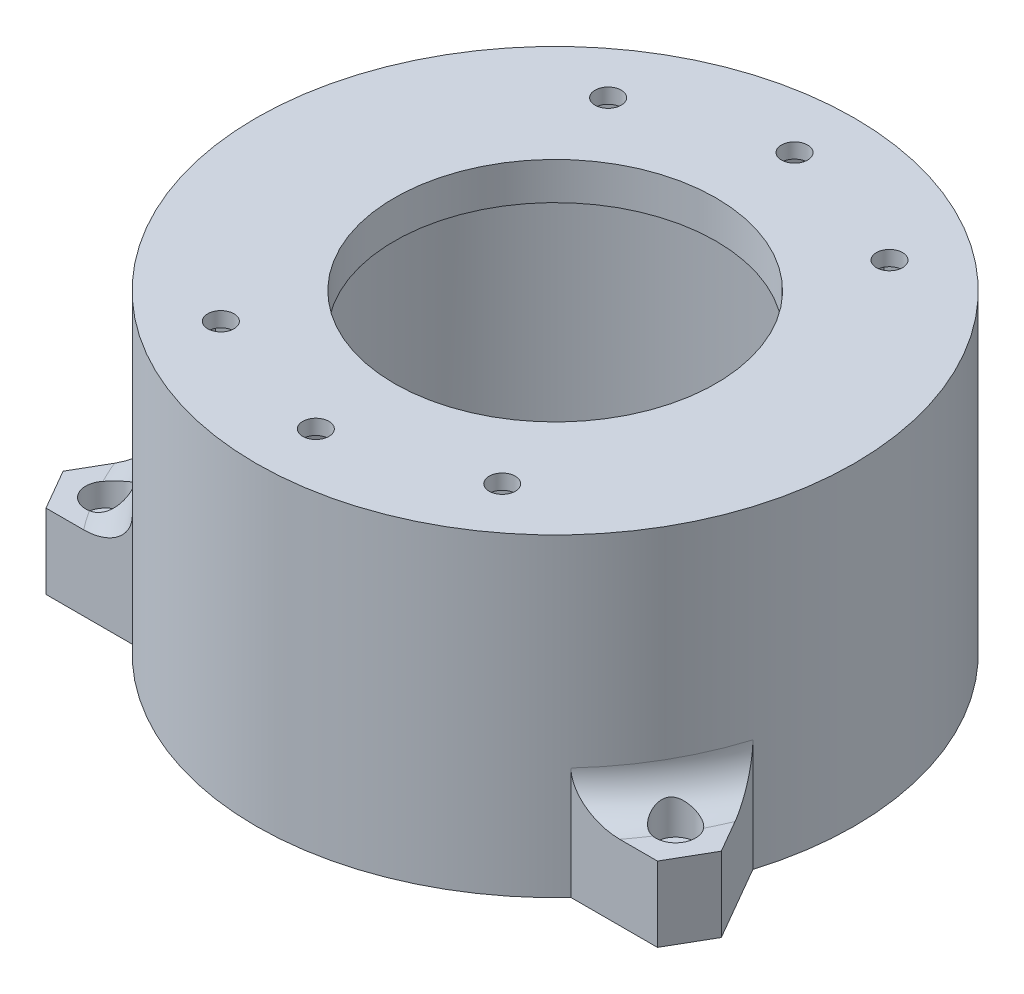
from build123d import *

# Parameters (mm, degrees)
SKETCH_1_W               = 40
SKETCH_1_H               = 39
CUT_EXTRUDE_1_DEPTH      = 3
CUT_EXTRUDE_2_DEPTH      = 3
CUT_EXTRUDE_3_DEPTH      = 3
CUT_EXTRUDE_4_DEPTH      = 3
CUT_EXTRUDE_5_DEPTH      = 3
CUT_EXTRUDE_6_DEPTH      = 3
HOLE_WIZARD_3_5_3_5_1_D  = 3.5
SKETCH_14_R              = 40
SKETCH_14_R_2            = 37
EXTRUDE_1_DEPTH          = 3
EXTRUDE_2_DEPTH          = 10
FILLET_1_R               = 5
FILLET_2_R               = 5
CUT_EXTRUDE_8_REACH      = 80.109
SKETCH_20_R              = 1.45
CUT_EXTRUDE_9_DEPTH      = 10
CUT_EXTRUDE_9_DEPTH_BACK = 3.1
SKETCH_21_R              = 3.121637526
SKETCH_21_R_2            = 2.750833309
SKETCH_21_R_3            = 2.66


with BuildPart() as part:
    # 草图1 → 旋转1 (revolve)
    with BuildSketch(Plane.XY, mode=Mode.PRIVATE) as revolve_1_sk:
        with Locations((20, 19.5)):
            Rectangle(SKETCH_1_W, SKETCH_1_H)
    revolve(revolve_1_sk.sketch.rotate(Axis((0, 39, 0), (0, -1, 0)), 270), axis=Axis((0, 39, 0), (0, -1, 0)))

    # 草图2 → M64 六角头螺栓的柱形沉头孔1 (revolve, cut)
    with BuildSketch(Plane(origin=(0, 39, 0), x_dir=(0, 0, 1), z_dir=(1, 0, 0))):
        Polygon((0, 0), (0, 39), (37, 39), (37, 5), (21.5, 5), (21.5, 0), align=None)
    revolve(axis=Axis((0, 45.35, 0), (0, -1, 0)), mode=Mode.SUBTRACT)

    # 草图4 → 切除-拉伸1 (cut)
    with BuildSketch(Plane.XZ.offset(-34)):
        Polygon((16.100028232, 27.856820067), (15.750000921, 24.52653266), (18.459100762, 22.558256413), (21.518227914, 23.920267573), (21.868255226, 27.25055498), (19.159155385, 29.218831227), align=None)
    extrude(amount=-CUT_EXTRUDE_1_DEPTH, mode=Mode.SUBTRACT)

    # 草图5 → 切除-拉伸2 (cut)
    with BuildSketch(Plane.XZ.offset(-34)):
        Polygon((-21.868255226, 27.25055498), (-21.518227914, 23.920267573), (-18.459100762, 22.558256413), (-15.750000921, 24.52653266), (-16.100028232, 27.856820067), (-19.159155385, 29.218831227), align=None)
    extrude(amount=-CUT_EXTRUDE_2_DEPTH, mode=Mode.SUBTRACT)

    # 草图6 → 切除-拉伸3 (cut)
    with BuildSketch(Plane.XZ.offset(-34)):
        Polygon((-18.459100762, -22.558256413), (-21.518227914, -23.920267573), (-21.868255226, -27.25055498), (-19.159155385, -29.218831227), (-16.100028232, -27.856820067), (-15.750000921, -24.52653266), align=None)
    extrude(amount=-CUT_EXTRUDE_3_DEPTH, mode=Mode.SUBTRACT)

    # 草图7 → 切除-拉伸4 (cut)
    with BuildSketch(Plane.XZ.offset(-34)):
        Polygon((1.674315781, -29.1), (-1.674315781, -29.1), (-3.348631561, -32), (-1.674315781, -34.9), (1.674315781, -34.9), (3.348631561, -32), align=None)
    extrude(amount=-CUT_EXTRUDE_4_DEPTH, mode=Mode.SUBTRACT)

    # 草图8 → 切除-拉伸5 (cut)
    with BuildSketch(Plane.XZ.offset(-34)):
        Polygon((21.868255226, -27.25055498), (21.518227914, -23.920267573), (18.459100762, -22.558256413), (15.750000921, -24.52653266), (16.100028232, -27.856820067), (19.159155385, -29.218831227), align=None)
    extrude(amount=-CUT_EXTRUDE_5_DEPTH, mode=Mode.SUBTRACT)

    # 草图9 → 切除-拉伸6 (cut)
    with BuildSketch(Plane.XZ.offset(-34)):
        Polygon((-3.348631561, 32), (-1.674315781, 29.1), (1.674315781, 29.1), (3.348631561, 32), (1.674315781, 34.9), (-1.674315781, 34.9), align=None)
    extrude(amount=-CUT_EXTRUDE_6_DEPTH, mode=Mode.SUBTRACT)

    # Ø3.5 (3.5) 直径孔1 (through all)
    with Locations(Plane(origin=(0, 37, 0), x_dir=(-1, 0, 0), z_dir=(0, -1, 0))):
        with Locations((18.809128073, 25.88854382), (-18.809128073, 25.88854382), (0, 32), (18.809128073, -25.88854382), (-18.809128073, -25.88854382), (0, -32)):
            Hole(HOLE_WIZARD_3_5_3_5_1_D / 2)

    # 草图14 → 凸台-拉伸1 (add)
    with BuildSketch(Plane.XZ):
        with Locations(Location((0, 0, 0), (0, 0, 270))):
            Circle(SKETCH_14_R)
        with Locations(Location((0, 0, 0), (0, 0, 90))):
            Circle(SKETCH_14_R_2, mode=Mode.SUBTRACT)
    extrude(amount=EXTRUDE_1_DEPTH)

    # 草图15 → 凸台-拉伸2 (add)
    with BuildSketch(Plane.XZ.offset(3)):
        Polygon((29.327322558, 27.208971895), (38.222658937, 11.791028105), (43.998438168, 21.790578059), (40.875075675, 27.204181918), align=None)
        Polygon((8.899999593, -39.002692308), (-8.899999593, -38.997307692), (-3.128024922, -48.99905421), (3.121974792, -49.000944875), align=None)
        Polygon((-38.227322151, 11.793720413), (-29.322659344, 27.206279587), (-40.870413246, 27.208476151), (-43.997050467, 21.796762958), align=None)
    extrude(amount=-EXTRUDE_2_DEPTH)

    # 圆角1
    # the kernel refuses this fillet: 5 mm, written as the material it adds along each edge
    with BuildSketch(Plane(origin=(0, 7, 0), x_dir=(0, 0, -1), z_dir=(1, 0, 0))) as fillet_1_piece_1_section:
        with BuildLine():
            CenterArc((40 + FILLET_1_R, FILLET_1_R), FILLET_1_R, 180, 90)
            Line((40 + FILLET_1_R, 0), (40, 0))
            Line((40, 0), (40, FILLET_1_R))
        make_face()
    fillet_1_piece_1 = revolve(axis=Axis((0, 7, 0), (0, 1, 0)), revolution_arc=30.760989805, mode=Mode.PRIVATE)
    fillet_1_piece_1 = split(fillet_1_piece_1, bisect_by=Plane(origin=(-6.938848229, 8.159603728, -42.395614154), z_dir=(0.866120495946599, 0, 0.4998352593617396)), keep=Keep.TOP, mode=Mode.PRIVATE)
    add(fillet_1_piece_1)
    with BuildSketch(Plane(origin=(0, 7, 0), x_dir=(0.510937919824611, 0, -0.8596176138756695), z_dir=(0.8596176138756695, 0, 0.510937919824611))) as fillet_1_piece_2_section:
        with BuildLine():
            CenterArc((40 + FILLET_1_R, FILLET_1_R), FILLET_1_R, 180, 90)
            Line((40 + FILLET_1_R, 0), (40, 0))
            Line((40, 0), (40, FILLET_1_R))
        make_face()
    fillet_1_piece_2 = revolve(axis=Axis((0, 7, 0), (0, 1, 0)), revolution_arc=30.726324325, mode=Mode.PRIVATE)
    fillet_1_piece_2 = split(fillet_1_piece_2, bisect_by=Plane(origin=(4.116270695, 8.159650312, -39.001245199), z_dir=(-0.0003025064822812723, 0, -0.9999999542449131)), keep=Keep.TOP, mode=Mode.PRIVATE)
    fillet_1_piece_2 = split(fillet_1_piece_2, bisect_by=Plane(origin=(6.938556974, 8.159650312, -42.396758511), z_dir=(-0.865817930630708, 0, 0.500359181986659)), keep=Keep.TOP, mode=Mode.PRIVATE)
    add(fillet_1_piece_2)

    # 圆角2
    # the kernel refuses this fillet: 5 mm, written as the material it adds along each edge
    with BuildSketch(Plane(origin=(0, 7, 0), x_dir=(-0.9999195538304662, 0, -0.01268407929183255), z_dir=(0.01268407929183255, 0, -0.9999195538304662))) as fillet_2_piece_1_section:
        with BuildLine():
            CenterArc((40 + FILLET_2_R, FILLET_2_R), FILLET_2_R, 180, 90)
            Line((40, FILLET_2_R), (40, 0))
            Line((40, 0), (40 + FILLET_2_R, 0))
        make_face()
    fillet_2_piece_1 = revolve(axis=Axis((0, 7, 0), (0, 1, 0)), revolution_arc=61.488192088, mode=Mode.PRIVATE)
    fillet_2_piece_1 = split(fillet_2_piece_1, bisect_by=Plane(origin=(-33.775857592, 8.159626542, 19.49849963), z_dir=(-0.8658741109182307, 0, 0.5002619554209213)), keep=Keep.TOP, mode=Mode.PRIVATE)
    fillet_2_piece_1 = split(fillet_2_piece_1, bisect_by=Plane(origin=(-41.214638413, 8.159626542, 16.972864045), z_dir=(0.8662327279326016, 0, 0.4996407319849368)), keep=Keep.TOP, mode=Mode.PRIVATE)
    fillet_2_piece_1 = split(fillet_2_piece_1, bisect_by=Plane(origin=(-35.303320955, 8.159626542, 27.207417203), z_dir=(-0.00019021565884901444, 0, -0.9999999819090014)), keep=Keep.TOP, mode=Mode.PRIVATE)
    add(fillet_2_piece_1)
    with BuildSketch(Plane(origin=(0, 7, 0), x_dir=(0.4889750420250284, 0, 0.8722977750038238), z_dir=(-0.8722977750038238, 0, 0.4889750420250284))) as fillet_2_piece_2_section:
        with BuildLine():
            CenterArc((40 + FILLET_2_R, FILLET_2_R), FILLET_2_R, 180, 90)
            Line((40, FILLET_2_R), (40, 0))
            Line((40, 0), (40 + FILLET_2_R, 0))
        make_face()
    fillet_2_piece_2 = revolve(axis=Axis((0, 7, 0), (0, 1, 0)), revolution_arc=61.488192088, mode=Mode.PRIVATE)
    fillet_2_piece_2 = split(fillet_2_piece_2, bisect_by=Plane(origin=(33.774124811, 8.159626542, 19.501500894), z_dir=(0.8661766174005117, 0, 0.49973799882399134)), keep=Keep.TOP, mode=Mode.PRIVATE)
    fillet_2_piece_2 = split(fillet_2_piece_2, bisect_by=Plane(origin=(35.306250644, 8.159626542, 27.206491851), z_dir=(-0.0004147973018910844, 0, -0.9999999139715955)), keep=Keep.TOP, mode=Mode.PRIVATE)
    fillet_2_piece_2 = split(fillet_2_piece_2, bisect_by=Plane(origin=(41.213974946, 8.159626542, 16.969864183), z_dir=(-0.8659302802877497, 0, 0.5001647225472617)), keep=Keep.TOP, mode=Mode.PRIVATE)
    add(fillet_2_piece_2)

    # 草图20 → 切除-拉伸8 (cut, up to next)
    with BuildSketch(Plane.XZ.offset(3), mode=Mode.PRIVATE) as cut_extrude_8_sk1:
        with Locations(Location((0.000280142, -44.000000314, 0), (0, 0, 270))):
            Circle(SKETCH_20_R)
    cut_extrude_8_tool1 = extrude(cut_extrude_8_sk1.sketch, amount=-CUT_EXTRUDE_8_REACH, mode=Mode.PRIVATE) & part.part
    # 草图20 → 切除-拉伸8 (cut, up to next)
    with BuildSketch(Plane.XZ.offset(3), mode=Mode.PRIVATE) as cut_extrude_8_sk2:
        with Locations(Location((-38.105258109, 21.999757547, 0), (0, 0, 270))):
            Circle(SKETCH_20_R)
    cut_extrude_8_tool2 = extrude(cut_extrude_8_sk2.sketch, amount=-CUT_EXTRUDE_8_REACH, mode=Mode.PRIVATE) & part.part
    # 草图20 → 切除-拉伸8 (cut, up to next)
    with BuildSketch(Plane.XZ.offset(3), mode=Mode.PRIVATE) as cut_extrude_8_sk3:
        with Locations(Location((38.104977967, 22.000242767, 0), (0, 0, 270))):
            Circle(SKETCH_20_R)
    cut_extrude_8_tool3 = extrude(cut_extrude_8_sk3.sketch, amount=-CUT_EXTRUDE_8_REACH, mode=Mode.PRIVATE) & part.part
    add(cut_extrude_8_tool1.solids().sort_by_distance((0.00028, -3, -44))[0], mode=Mode.SUBTRACT)
    add(cut_extrude_8_tool2.solids().sort_by_distance((-38.105258, -3, 21.999758))[0], mode=Mode.SUBTRACT)
    add(cut_extrude_8_tool3.solids().sort_by_distance((38.104978, -3, 22.000243))[0], mode=Mode.SUBTRACT)

    # 草图21 → 切除-拉伸9 (cut, two sides: drawn at the far end of the back side and taken through both)
    # profile 1 of 4: a face of its own
    with BuildSketch(Plane(origin=(0, 7, 0), x_dir=(1, 0, 0), z_dir=(0, 1, 0)).offset(-CUT_EXTRUDE_9_DEPTH_BACK)):
        Circle(SKETCH_21_R)
        Circle(SKETCH_21_R_2, mode=Mode.SUBTRACT)
    # profile 2 of 4: a face of its own
    with BuildSketch(Plane(origin=(0, 7, 0), x_dir=(1, 0, 0), z_dir=(0, 1, 0)).offset(-CUT_EXTRUDE_9_DEPTH_BACK)):
        with Locations(Location((0.000280142, 44.000000314, 0), (0, 0, 159.513268141))):
            Circle(SKETCH_21_R_3)
    # profile 3 of 4: a face of its own
    with BuildSketch(Plane(origin=(0, 7, 0), x_dir=(1, 0, 0), z_dir=(0, 1, 0)).offset(-CUT_EXTRUDE_9_DEPTH_BACK)):
        with Locations(Location((38.104977967, -22.000242767, 0), (0, 0, 39.513268136))):
            Circle(SKETCH_21_R_3)
    # profile 4 of 4: a face of its own
    with BuildSketch(Plane(origin=(0, 7, 0), x_dir=(1, 0, 0), z_dir=(0, 1, 0)).offset(-CUT_EXTRUDE_9_DEPTH_BACK)):
        with Locations(Location((-38.105258109, -21.999757547, 0), (0, 0, 140.486002271))):
            Circle(SKETCH_21_R_3)
    extrude(amount=CUT_EXTRUDE_9_DEPTH + CUT_EXTRUDE_9_DEPTH_BACK, mode=Mode.SUBTRACT)


solid = part.part
